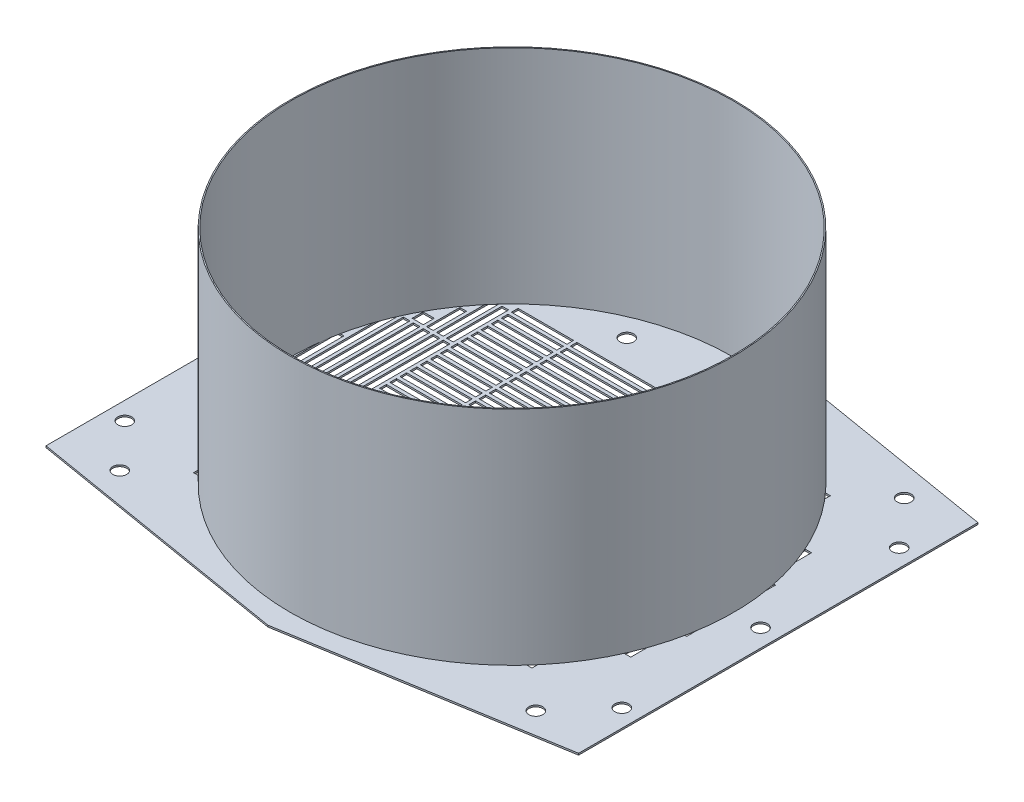
from build123d import *

# Parameters (mm, degrees)
BASE_FLANGE1_DEPTH                    = 200
BASE_FLANGE2_START                    = -1.5
BASE_FLANGE2_DEPTH                    = 1.5
SKETCH9_W                             = 6.25
SKETCH9_H                             = 1.5
F_12_5_12_5_DIAMETER_HOLE2_AT_2_COUNT = 2
F_12_5_12_5_DIAMETER_HOLE2_AT_2_PITCH = 250
F_12_5_12_5_DIAMETER_HOLE2_AT_3_COUNT = 2
F_12_5_12_5_DIAMETER_HOLE2_AT_3_PITCH = 125
F_12_5_12_5_DIAMETER_HOLE2_AT_4_COUNT = 2
F_12_5_12_5_DIAMETER_HOLE2_AT_4_PITCH = 465.111814513
F_12_5_12_5_DIAMETER_HOLE2_AT_5_COUNT = 2
F_12_5_12_5_DIAMETER_HOLE2_AT_5_PITCH = 513.034111926
F_12_5_12_5_DIAMETER_HOLE2_AT_6_COUNT = 2
F_12_5_12_5_DIAMETER_HOLE2_AT_6_PITCH = 448
SKETCH11_W                            = 6.25
SKETCH11_H                            = 1.5
F_12_5_12_5_DIAMETER_HOLE3_AT_2_COUNT = 2
F_12_5_12_5_DIAMETER_HOLE3_AT_2_PITCH = 332
CRVPATTERN1_COUNT                     = 4
CRVPATTERN1_PITCH                     = 125
CRVPATTERN1_COPY_1_SKETCH_W           = 6.25
CRVPATTERN1_COPY_1_SKETCH_H           = 1.5
CRVPATTERN1_COPY_2_SKETCH_W           = 6.25
CRVPATTERN1_COPY_2_SKETCH_H           = 1.5
CRVPATTERN1_COPY_3_SKETCH_W           = 6.25
CRVPATTERN1_COPY_3_SKETCH_H           = 1.5
BASE_FLANGE3_DEPTH                    = 1.5
SKETCH14_W                            = 80
SKETCH14_H                            = 6
SKETCH14_W_2                          = 50
EXTRUDE1_DEPTH                        = 10
CRVPATTERN2_START                     = -81.5
CRVPATTERN2_OUTLINE_W                 = 1.5
CRVPATTERN2_OUTLINE_H                 = 6
CRVPATTERN2_DEPTH                     = 80
CRVPATTERN2_START_2                   = -134.5
CRVPATTERN2_2_OUTLINE_W               = 1.5
CRVPATTERN2_2_OUTLINE_H               = 6
CRVPATTERN2_2_DEPTH                   = 50
SKETCH15_W                            = 6
SKETCH15_H                            = 80
SKETCH15_H_2                          = 50
SKETCH15_H_3                          = 30
SKETCH15_W_2                          = 10
SKETCH15_H_4                          = 10
EXTRUDE2_DEPTH                        = 10


# Read off the part's stored shape, not the designer's step: CrvPattern2
# Sheet-metal steps are written as plain solids
with BuildPart() as part:
    # Sketch1 → Base-Flange1 (new body)
    with BuildSketch(Plane(origin=(0, 0, 0), x_dir=(1, 0, 0), z_dir=(0, 1, 0))):
        with BuildLine():
            ThreePointArc((-0.005, 198.999999937), (0, -199), (0.005, 198.999999937))
            Line((0.005, 198.999999937), (0.005025126, 199.999999937))
            ThreePointArc((0.005025126, 199.999999937), (0, -200), (-0.005025126, 199.999999937))
            Line((-0.005025126, 199.999999937), (-0.005, 198.999999937))
        make_face()
    extrude(amount=BASE_FLANGE1_DEPTH)


with BuildPart() as body_2:
    # Sketch4 → Base-Flange2 (new body)
    with BuildSketch(Plane(origin=(0, 0, 0), x_dir=(1, 0, 0), z_dir=(0, 1, 0)).offset(BASE_FLANGE2_START)):
        Polygon((240, 180), (240, -180), (0, -220), (-240, -180), (-240, 180), (0, 220), align=None)
        with BuildLine():
            Line((143.038535018, 140), (-142.828568571, 140))
            ThreePointArc((-142.828568571, 140), (-200, 0), (-142.828568571, -140))
            Line((-142.828568571, -140), (143.038535018, -140))
            ThreePointArc((143.038535018, -140), (200.15, 0), (143.038535018, 140))
        make_face(mode=Mode.SUBTRACT)
    extrude(amount=BASE_FLANGE2_DEPTH)

    # Sketch9 → Ø12.5 (12.5) Diameter Hole2 (revolve, cut)
    with BuildSketch(Plane(origin=(-224, 0, -125), x_dir=(0, 0, 1), z_dir=(1, 0, 0))):
        with Locations((3.125, 0.75)):
            Rectangle(SKETCH9_W, SKETCH9_H)
    f_12_5_12_5_diameter_hole2 = revolve(axis=Axis((-224, 6.35, -125), (0, -1, 0)), mode=Mode.SUBTRACT)

    # Ø12.5 (12.5) Diameter Hole2 at 2: Ø12.5 (12.5) Diameter Hole2 ×2
    with Locations(*[(0, 0, i * F_12_5_12_5_DIAMETER_HOLE2_AT_2_PITCH) for i in range(1, F_12_5_12_5_DIAMETER_HOLE2_AT_2_COUNT)]):
        add(f_12_5_12_5_diameter_hole2, mode=Mode.SUBTRACT)

    # Ø12.5 (12.5) Diameter Hole2 at 3: Ø12.5 (12.5) Diameter Hole2 ×2
    with Locations(*[(0, 0, i * F_12_5_12_5_DIAMETER_HOLE2_AT_3_PITCH) for i in range(1, F_12_5_12_5_DIAMETER_HOLE2_AT_3_COUNT)]):
        add(f_12_5_12_5_diameter_hole2, mode=Mode.SUBTRACT)

    # Ø12.5 (12.5) Diameter Hole2 at 4: Ø12.5 (12.5) Diameter Hole2 ×2
    with Locations(*[Vector(0.9632092456491202, 0, 0.2687525797012055) * (i * F_12_5_12_5_DIAMETER_HOLE2_AT_4_PITCH) for i in range(1, F_12_5_12_5_DIAMETER_HOLE2_AT_4_COUNT)]):
        add(f_12_5_12_5_diameter_hole2, mode=Mode.SUBTRACT)

    # Ø12.5 (12.5) Diameter Hole2 at 5: Ø12.5 (12.5) Diameter Hole2 ×2
    with Locations(*[Vector(0.8732362811468641, 0, 0.4872970318899912) * (i * F_12_5_12_5_DIAMETER_HOLE2_AT_5_PITCH) for i in range(1, F_12_5_12_5_DIAMETER_HOLE2_AT_5_COUNT)]):
        add(f_12_5_12_5_diameter_hole2, mode=Mode.SUBTRACT)

    # Ø12.5 (12.5) Diameter Hole2 at 6: Ø12.5 (12.5) Diameter Hole2 ×2
    with Locations(*[(i * F_12_5_12_5_DIAMETER_HOLE2_AT_6_PITCH, 0, 0) for i in range(1, F_12_5_12_5_DIAMETER_HOLE2_AT_6_COUNT)]):
        add(f_12_5_12_5_diameter_hole2, mode=Mode.SUBTRACT)

    # Sketch11 → Ø12.5 (12.5) Diameter Hole3 (revolve, cut)
    with BuildSketch(Plane(origin=(-187.5, 0, -166), x_dir=(0, 0, 1), z_dir=(1, 0, 0))):
        with Locations((3.125, 0.75)):
            Rectangle(SKETCH11_W, SKETCH11_H)
    f_12_5_12_5_diameter_hole3 = revolve(axis=Axis((-187.5, 6.35, -166), (0, -1, 0)), mode=Mode.SUBTRACT)

    # Ø12.5 (12.5) Diameter Hole3 at 2: Ø12.5 (12.5) Diameter Hole3 ×2
    with Locations(*[(0, 0, i * F_12_5_12_5_DIAMETER_HOLE3_AT_2_PITCH) for i in range(1, F_12_5_12_5_DIAMETER_HOLE3_AT_2_COUNT)]):
        add(f_12_5_12_5_diameter_hole3, mode=Mode.SUBTRACT)

    # CrvPattern1: Ø12.5 (12.5) Diameter Hole3 ×4
    with Locations(*[(i * CRVPATTERN1_PITCH, 0, 0) for i in range(1, CRVPATTERN1_COUNT)]):
        add(f_12_5_12_5_diameter_hole3, mode=Mode.SUBTRACT)

    # CrvPattern1 copy 1 sketch → CrvPattern1 copy 1 (revolve, cut)
    with BuildSketch(Plane(origin=(-62.5, 0, 166), x_dir=(0, 0, 1), z_dir=(1, 0, 0))):
        with Locations((3.125, 0.75)):
            Rectangle(CRVPATTERN1_COPY_1_SKETCH_W, CRVPATTERN1_COPY_1_SKETCH_H)
    revolve(axis=Axis((-62.5, 6.35, 166), (0, -1, 0)), mode=Mode.SUBTRACT)

    # CrvPattern1 copy 2 sketch → CrvPattern1 copy 2 (revolve, cut)
    with BuildSketch(Plane(origin=(62.5, 0, 166), x_dir=(0, 0, 1), z_dir=(1, 0, 0))):
        with Locations((3.125, 0.75)):
            Rectangle(CRVPATTERN1_COPY_2_SKETCH_W, CRVPATTERN1_COPY_2_SKETCH_H)
    revolve(axis=Axis((62.5, 6.35, 166), (0, -1, 0)), mode=Mode.SUBTRACT)

    # CrvPattern1 copy 3 sketch → CrvPattern1 copy 3 (revolve, cut)
    with BuildSketch(Plane(origin=(187.5, 0, 166), x_dir=(0, 0, 1), z_dir=(1, 0, 0))):
        with Locations((3.125, 0.75)):
            Rectangle(CRVPATTERN1_COPY_3_SKETCH_W, CRVPATTERN1_COPY_3_SKETCH_H)
    revolve(axis=Axis((187.5, 6.35, 166), (0, -1, 0)), mode=Mode.SUBTRACT)

    # Sketch13 → Base-Flange3 (add)
    with BuildSketch(Plane.XZ.offset(1.5)):
        with BuildLine():
            Line((-142.828568571, -140), (143.038535018, -140))
            ThreePointArc((143.038535018, -140), (200.15, 0), (143.038535018, 140))
            Line((143.038535018, 140), (-142.828568571, 140))
            ThreePointArc((-142.828568571, 140), (-200, 0), (-142.828568571, -140))
        make_face()
    extrude(amount=-BASE_FLANGE3_DEPTH)

    # Sketch14 → Extrude1 (cut)
    with BuildSketch(Plane(origin=(0, 0, 0), x_dir=(1, 0, 0), z_dir=(0, 1, 0))):
        with Locations((-41.5, 137)):
            Rectangle(SKETCH14_W, SKETCH14_H)
        with Locations((-109.5, 137)):
            Rectangle(SKETCH14_W_2, SKETCH14_H)
    extrude1 = extrude(amount=-EXTRUDE1_DEPTH, mode=Mode.SUBTRACT)

    # CrvPattern2 outline → CrvPattern2 (cut)
    with BuildSketch(Plane.YZ.offset(CRVPATTERN2_START)):
        with Locations((-0.75, -127.866666667)):
            Rectangle(CRVPATTERN2_OUTLINE_W, CRVPATTERN2_OUTLINE_H)
        with Locations((-0.75, -118.733333333)):
            Rectangle(CRVPATTERN2_OUTLINE_W, CRVPATTERN2_OUTLINE_H)
        with Locations((-0.75, -109.6)):
            Rectangle(CRVPATTERN2_OUTLINE_W, CRVPATTERN2_OUTLINE_H)
        with Locations((-0.75, -100.466666667)):
            Rectangle(CRVPATTERN2_OUTLINE_W, CRVPATTERN2_OUTLINE_H)
        with Locations((-0.75, -91.333333333)):
            Rectangle(CRVPATTERN2_OUTLINE_W, CRVPATTERN2_OUTLINE_H)
        with Locations((-0.75, -82.2)):
            Rectangle(CRVPATTERN2_OUTLINE_W, CRVPATTERN2_OUTLINE_H)
        with Locations((-0.75, -73.066666667)):
            Rectangle(CRVPATTERN2_OUTLINE_W, CRVPATTERN2_OUTLINE_H)
        with Locations((-0.75, -63.933333333)):
            Rectangle(CRVPATTERN2_OUTLINE_W, CRVPATTERN2_OUTLINE_H)
        with Locations((-0.75, -54.8)):
            Rectangle(CRVPATTERN2_OUTLINE_W, CRVPATTERN2_OUTLINE_H)
        with Locations((-0.75, -45.666666667)):
            Rectangle(CRVPATTERN2_OUTLINE_W, CRVPATTERN2_OUTLINE_H)
        with Locations((-0.75, -36.533333333)):
            Rectangle(CRVPATTERN2_OUTLINE_W, CRVPATTERN2_OUTLINE_H)
        with Locations((-0.75, -27.4)):
            Rectangle(CRVPATTERN2_OUTLINE_W, CRVPATTERN2_OUTLINE_H)
        with Locations((-0.75, -18.266666667)):
            Rectangle(CRVPATTERN2_OUTLINE_W, CRVPATTERN2_OUTLINE_H)
        with Locations((-0.75, -9.133333333)):
            Rectangle(CRVPATTERN2_OUTLINE_W, CRVPATTERN2_OUTLINE_H)
        with Locations((-0.75, 0)):
            Rectangle(CRVPATTERN2_OUTLINE_W, CRVPATTERN2_OUTLINE_H)
        with Locations((-0.75, 9.133333333)):
            Rectangle(CRVPATTERN2_OUTLINE_W, CRVPATTERN2_OUTLINE_H)
        with Locations((-0.75, 18.266666667)):
            Rectangle(CRVPATTERN2_OUTLINE_W, CRVPATTERN2_OUTLINE_H)
        with Locations((-0.75, 27.4)):
            Rectangle(CRVPATTERN2_OUTLINE_W, CRVPATTERN2_OUTLINE_H)
        with Locations((-0.75, 36.533333333)):
            Rectangle(CRVPATTERN2_OUTLINE_W, CRVPATTERN2_OUTLINE_H)
        with Locations((-0.75, 45.666666667)):
            Rectangle(CRVPATTERN2_OUTLINE_W, CRVPATTERN2_OUTLINE_H)
        with Locations((-0.75, 54.8)):
            Rectangle(CRVPATTERN2_OUTLINE_W, CRVPATTERN2_OUTLINE_H)
        with Locations((-0.75, 63.933333333)):
            Rectangle(CRVPATTERN2_OUTLINE_W, CRVPATTERN2_OUTLINE_H)
        with Locations((-0.75, 73.066666667)):
            Rectangle(CRVPATTERN2_OUTLINE_W, CRVPATTERN2_OUTLINE_H)
        with Locations((-0.75, 82.2)):
            Rectangle(CRVPATTERN2_OUTLINE_W, CRVPATTERN2_OUTLINE_H)
        with Locations((-0.75, 91.333333333)):
            Rectangle(CRVPATTERN2_OUTLINE_W, CRVPATTERN2_OUTLINE_H)
        with Locations((-0.75, 100.466666667)):
            Rectangle(CRVPATTERN2_OUTLINE_W, CRVPATTERN2_OUTLINE_H)
        with Locations((-0.75, 109.6)):
            Rectangle(CRVPATTERN2_OUTLINE_W, CRVPATTERN2_OUTLINE_H)
        with Locations((-0.75, 118.733333333)):
            Rectangle(CRVPATTERN2_OUTLINE_W, CRVPATTERN2_OUTLINE_H)
        with Locations((-0.75, 127.866666667)):
            Rectangle(CRVPATTERN2_OUTLINE_W, CRVPATTERN2_OUTLINE_H)
        with Locations((-0.75, 137)):
            Rectangle(CRVPATTERN2_OUTLINE_W, CRVPATTERN2_OUTLINE_H)
    crvpattern2 = extrude(amount=CRVPATTERN2_DEPTH, mode=Mode.SUBTRACT)

    # CrvPattern2 2 outline → CrvPattern2 2 (cut)
    with BuildSketch(Plane.YZ.offset(CRVPATTERN2_START_2)):
        with Locations((-0.75, -127.866666667)):
            Rectangle(CRVPATTERN2_2_OUTLINE_W, CRVPATTERN2_2_OUTLINE_H)
        with Locations((-0.75, -118.733333333)):
            Rectangle(CRVPATTERN2_2_OUTLINE_W, CRVPATTERN2_2_OUTLINE_H)
        with Locations((-0.75, -109.6)):
            Rectangle(CRVPATTERN2_2_OUTLINE_W, CRVPATTERN2_2_OUTLINE_H)
        with Locations((-0.75, -100.466666667)):
            Rectangle(CRVPATTERN2_2_OUTLINE_W, CRVPATTERN2_2_OUTLINE_H)
        with Locations((-0.75, -91.333333333)):
            Rectangle(CRVPATTERN2_2_OUTLINE_W, CRVPATTERN2_2_OUTLINE_H)
        with Locations((-0.75, -82.2)):
            Rectangle(CRVPATTERN2_2_OUTLINE_W, CRVPATTERN2_2_OUTLINE_H)
        with Locations((-0.75, -73.066666667)):
            Rectangle(CRVPATTERN2_2_OUTLINE_W, CRVPATTERN2_2_OUTLINE_H)
        with Locations((-0.75, -63.933333333)):
            Rectangle(CRVPATTERN2_2_OUTLINE_W, CRVPATTERN2_2_OUTLINE_H)
        with Locations((-0.75, -54.8)):
            Rectangle(CRVPATTERN2_2_OUTLINE_W, CRVPATTERN2_2_OUTLINE_H)
        with Locations((-0.75, -45.666666667)):
            Rectangle(CRVPATTERN2_2_OUTLINE_W, CRVPATTERN2_2_OUTLINE_H)
        with Locations((-0.75, -36.533333333)):
            Rectangle(CRVPATTERN2_2_OUTLINE_W, CRVPATTERN2_2_OUTLINE_H)
        with Locations((-0.75, -27.4)):
            Rectangle(CRVPATTERN2_2_OUTLINE_W, CRVPATTERN2_2_OUTLINE_H)
        with Locations((-0.75, -18.266666667)):
            Rectangle(CRVPATTERN2_2_OUTLINE_W, CRVPATTERN2_2_OUTLINE_H)
        with Locations((-0.75, -9.133333333)):
            Rectangle(CRVPATTERN2_2_OUTLINE_W, CRVPATTERN2_2_OUTLINE_H)
        with Locations((-0.75, 0)):
            Rectangle(CRVPATTERN2_2_OUTLINE_W, CRVPATTERN2_2_OUTLINE_H)
        with Locations((-0.75, 9.133333333)):
            Rectangle(CRVPATTERN2_2_OUTLINE_W, CRVPATTERN2_2_OUTLINE_H)
        with Locations((-0.75, 18.266666667)):
            Rectangle(CRVPATTERN2_2_OUTLINE_W, CRVPATTERN2_2_OUTLINE_H)
        with Locations((-0.75, 27.4)):
            Rectangle(CRVPATTERN2_2_OUTLINE_W, CRVPATTERN2_2_OUTLINE_H)
        with Locations((-0.75, 36.533333333)):
            Rectangle(CRVPATTERN2_2_OUTLINE_W, CRVPATTERN2_2_OUTLINE_H)
        with Locations((-0.75, 45.666666667)):
            Rectangle(CRVPATTERN2_2_OUTLINE_W, CRVPATTERN2_2_OUTLINE_H)
        with Locations((-0.75, 54.8)):
            Rectangle(CRVPATTERN2_2_OUTLINE_W, CRVPATTERN2_2_OUTLINE_H)
        with Locations((-0.75, 63.933333333)):
            Rectangle(CRVPATTERN2_2_OUTLINE_W, CRVPATTERN2_2_OUTLINE_H)
        with Locations((-0.75, 73.066666667)):
            Rectangle(CRVPATTERN2_2_OUTLINE_W, CRVPATTERN2_2_OUTLINE_H)
        with Locations((-0.75, 82.2)):
            Rectangle(CRVPATTERN2_2_OUTLINE_W, CRVPATTERN2_2_OUTLINE_H)
        with Locations((-0.75, 91.333333333)):
            Rectangle(CRVPATTERN2_2_OUTLINE_W, CRVPATTERN2_2_OUTLINE_H)
        with Locations((-0.75, 100.466666667)):
            Rectangle(CRVPATTERN2_2_OUTLINE_W, CRVPATTERN2_2_OUTLINE_H)
        with Locations((-0.75, 109.6)):
            Rectangle(CRVPATTERN2_2_OUTLINE_W, CRVPATTERN2_2_OUTLINE_H)
        with Locations((-0.75, 118.733333333)):
            Rectangle(CRVPATTERN2_2_OUTLINE_W, CRVPATTERN2_2_OUTLINE_H)
        with Locations((-0.75, 127.866666667)):
            Rectangle(CRVPATTERN2_2_OUTLINE_W, CRVPATTERN2_2_OUTLINE_H)
        with Locations((-0.75, 137)):
            Rectangle(CRVPATTERN2_2_OUTLINE_W, CRVPATTERN2_2_OUTLINE_H)
    crvpattern2_2 = extrude(amount=CRVPATTERN2_2_DEPTH, mode=Mode.SUBTRACT)

    # Sketch15 → Extrude2 (cut)
    with BuildSketch(Plane(origin=(0, 0, 0), x_dir=(1, 0, 0), z_dir=(0, 1, 0))):
        with Locations((-140.5, 41.5)):
            Rectangle(SKETCH15_W, SKETCH15_H)
        with Locations((-140.5, 109.5)):
            Rectangle(SKETCH15_W, SKETCH15_H_2)
        with Locations((-149.5, 41.5)):
            Rectangle(SKETCH15_W, SKETCH15_H)
        with Locations((-149.5, 109.5)):
            Rectangle(SKETCH15_W, SKETCH15_H_2)
        with Locations((-158.5, 41.5)):
            Rectangle(SKETCH15_W, SKETCH15_H)
        with Locations((-167.5, 41.5)):
            Rectangle(SKETCH15_W, SKETCH15_H)
        with Locations((-176.5, 41.5)):
            Rectangle(SKETCH15_W, SKETCH15_H)
        with Locations((-185.5, 41.5)):
            Rectangle(SKETCH15_W, SKETCH15_H)
        with Locations((-158.5, 99.5)):
            Rectangle(SKETCH15_W, SKETCH15_H_3)
        with Locations((-169.5, 89.5)):
            Rectangle(SKETCH15_W_2, SKETCH15_H_4)
        with Locations((-169.5, -89.5)):
            Rectangle(SKETCH15_W_2, SKETCH15_H_4)
        with Locations((-158.5, -99.5)):
            Rectangle(SKETCH15_W, SKETCH15_H_3)
        with Locations((-185.5, -41.5)):
            Rectangle(SKETCH15_W, SKETCH15_H)
        with Locations((-176.5, -41.5)):
            Rectangle(SKETCH15_W, SKETCH15_H)
        with Locations((-167.5, -41.5)):
            Rectangle(SKETCH15_W, SKETCH15_H)
        with Locations((-158.5, -41.5)):
            Rectangle(SKETCH15_W, SKETCH15_H)
        with Locations((-149.5, -109.5)):
            Rectangle(SKETCH15_W, SKETCH15_H_2)
        with Locations((-149.5, -41.5)):
            Rectangle(SKETCH15_W, SKETCH15_H)
        with Locations((-140.5, -109.5)):
            Rectangle(SKETCH15_W, SKETCH15_H_2)
        with Locations((-140.5, -41.5)):
            Rectangle(SKETCH15_W, SKETCH15_H)
        with Locations((-194.5, 0)):
            Rectangle(SKETCH15_W, SKETCH15_H)
    extrude2 = extrude(amount=-EXTRUDE2_DEPTH, mode=Mode.SUBTRACT)

    # Mirror1: Extrude1, CrvPattern2, CrvPattern2 2, Extrude2 across plane
    add(extrude1.mirror(Plane(origin=(0, 0, 0), x_dir=(0, 0, 1), z_dir=(1, 0, 0))), mode=Mode.SUBTRACT)
    add(crvpattern2.mirror(Plane(origin=(0, 0, 0), x_dir=(0, 0, 1), z_dir=(1, 0, 0))), mode=Mode.SUBTRACT)
    add(crvpattern2_2.mirror(Plane(origin=(0, 0, 0), x_dir=(0, 0, 1), z_dir=(1, 0, 0))), mode=Mode.SUBTRACT)
    add(extrude2.mirror(Plane(origin=(0, 0, 0), x_dir=(0, 0, 1), z_dir=(1, 0, 0))), mode=Mode.SUBTRACT)


solid = Compound([part.part, body_2.part])
